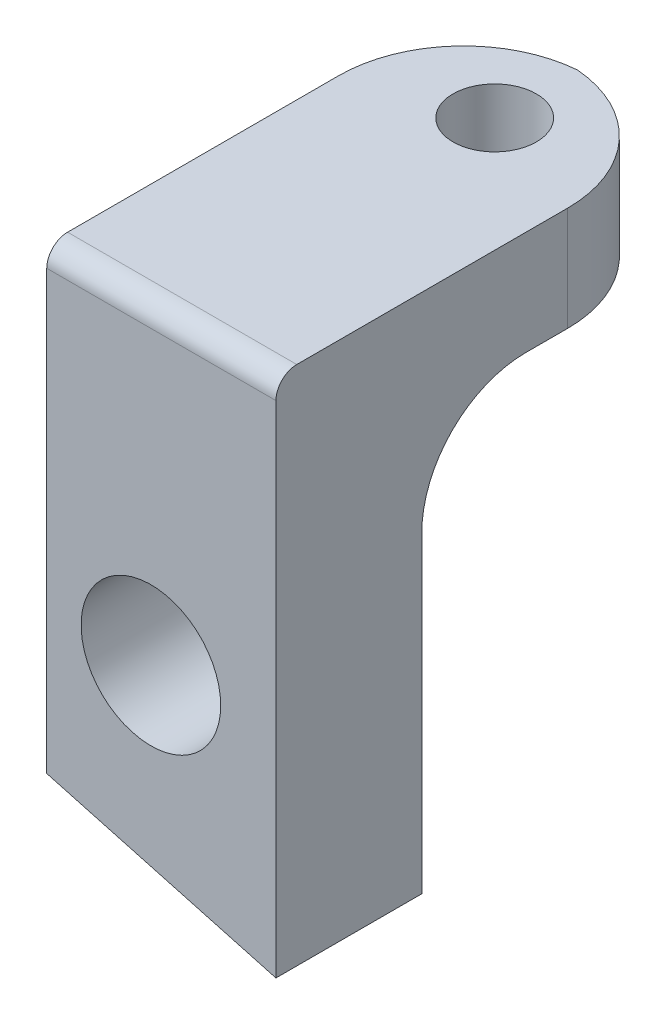
from build123d import *

# Parameters (mm, degrees)
SKETCH_1_R          = 3.35
EXTRUDE_1_DEPTH     = 7
SKETCH_2_W          = 11
SKETCH_2_H          = 20
EXTRUDE_2_DEPTH     = 5
FILLET_1_R          = 5
FILLET_2_R          = 1
FILLET_4_R          = 1
FILLET_11_R         = 6
SKETCH_3_R          = 2
CUT_EXTRUDE_2_DEPTH = 10


with BuildPart() as part:
    # Эскиз1 → Бобышка-Вытянуть1 (new body)
    with BuildSketch(Plane.XY):
        Polygon((-5, 10), (6, 10), (6, -10), (-5, -7), align=None)
        Circle(SKETCH_1_R, mode=Mode.SUBTRACT)
    extrude(amount=EXTRUDE_1_DEPTH)

    # Эскиз2 → Бобышка-Вытянуть2 (add)
    with BuildSketch(Plane(origin=(0, 10, 0), x_dir=(1, 0, 0), z_dir=(0, 1, 0))):
        with Locations((0.5, 3)):
            Rectangle(SKETCH_2_W, SKETCH_2_H)
    extrude(amount=EXTRUDE_2_DEPTH)

    # Скругление1
    fillet_1_edges = [part.edges().sort_by_distance(p)[0] for p in [
        (0.5, 10, 0),
    ]]
    fillet(fillet_1_edges, radius=FILLET_1_R)

    # Скругление2
    fillet_2_edges = [part.edges().sort_by_distance(p)[0] for p in [
        (-3.35, 0, 0),
    ]]
    fillet(fillet_2_edges, radius=FILLET_2_R)

    # Скругление4
    fillet_4_edges = [part.edges().sort_by_distance(p)[0] for p in [
        (0.5, 15, 7),
    ]]
    fillet(fillet_4_edges, radius=FILLET_4_R)

    # Скругление11
    # the kernel refuses this fillet: 6 mm, written as the material it takes off along each edge
    with BuildSketch(Plane(origin=(6, -5, -13), x_dir=(0, 0, 1), z_dir=(0, 1, 0)), Plane(origin=(-5, -5, -13), x_dir=(1, 0, 0), z_dir=(0, 1, 0))) as fillet_11_piece_1:
        with BuildLine():
            CenterArc((FILLET_11_R, -FILLET_11_R), FILLET_11_R, 90, 90)
            Line((0, -FILLET_11_R), (0, 0))
            Line((0, 0), (FILLET_11_R, 0))
        make_face()
    extrude(amount=35, mode=Mode.SUBTRACT)

    # Эскиз3 → Вырез-Вытянуть2 (cut)
    with BuildSketch(Plane.XZ.offset(-10)):
        with Locations(Location((0.5, -9, 0), (0, 0, 270))):
            Circle(SKETCH_3_R)
    extrude(amount=-CUT_EXTRUDE_2_DEPTH, mode=Mode.SUBTRACT)


solid = part.part
